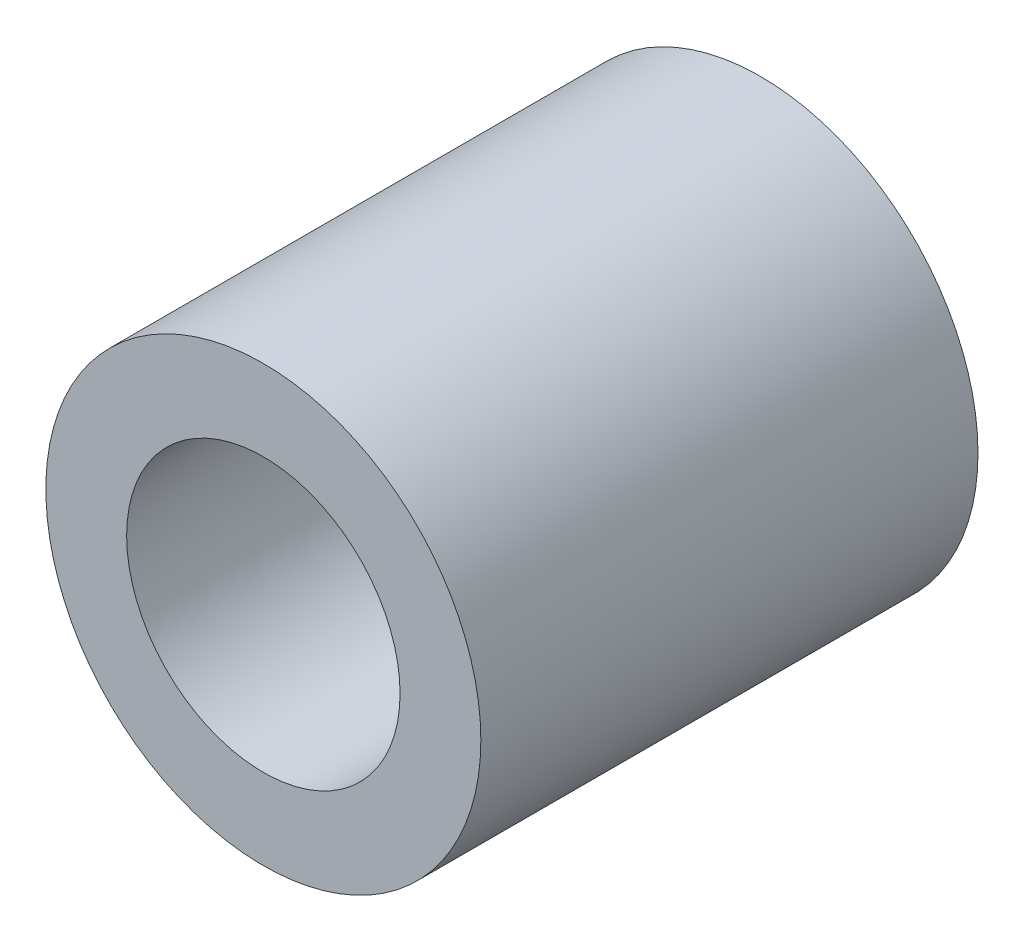
from build123d import *

# Parameters (mm, degrees)
SKETCH1_R           = 7
SKETCH1_R_2         = 4.4
BOSS_EXTRUDE1_DEPTH = 16


with BuildPart() as part:
    # Sketch1 → Boss-Extrude1 (new body)
    with BuildSketch(Plane.XY):
        Circle(SKETCH1_R)
        Circle(SKETCH1_R_2, mode=Mode.SUBTRACT)
    extrude(amount=BOSS_EXTRUDE1_DEPTH)


solid = part.part
